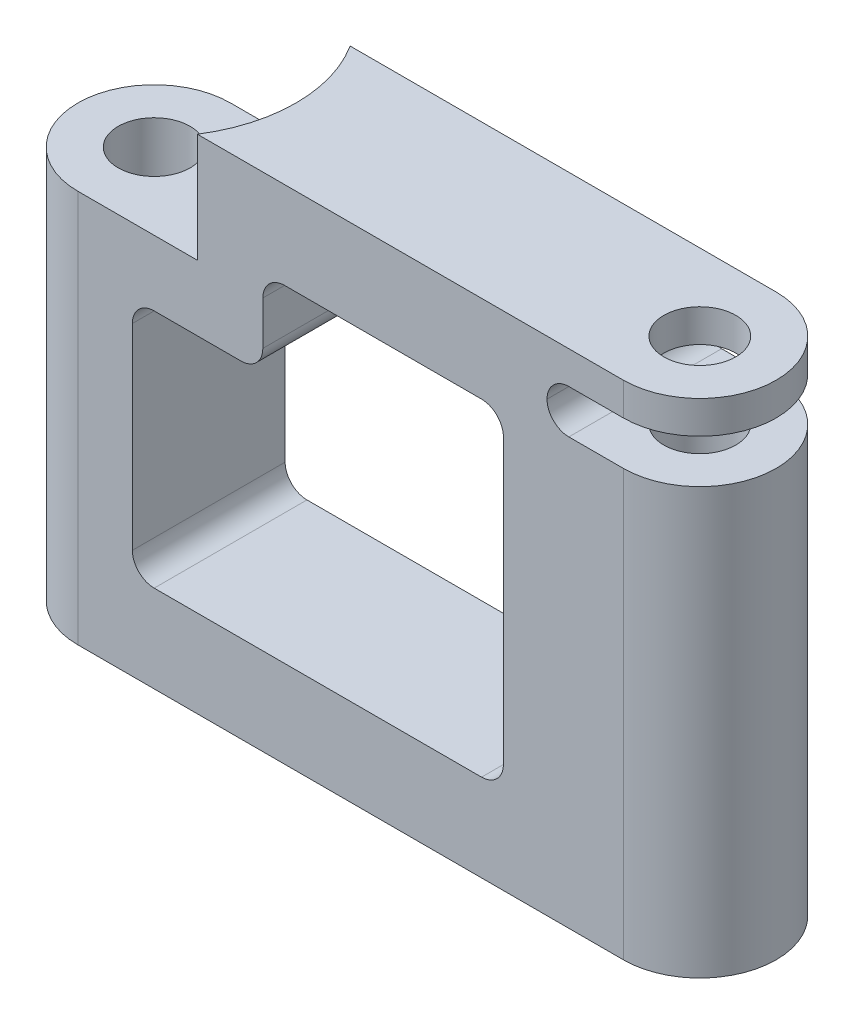
from build123d import *

# Parameters (mm, degrees)
EXTRUDE_1_DEPTH     = 11.5
SKETCH_2_R          = 1.65
CUT_EXTRUDE_1_DEPTH = 46.5
SKETCH_4_R          = 6.5
CUT_EXTRUDE_2_DEPTH = 5
SKETCH_5_W          = 7
SKETCH_5_H          = 2
CUT_EXTRUDE_3_DEPTH = 10
FILLET_1_R          = 1
CUT_EXTRUDE_4_DEPTH = 25
FILLET_2_R          = 1


with BuildPart() as part:
    # 草图1 → 凸台-拉伸1 (new, symmetric)
    with BuildSketch(Plane(origin=(0, 0, 0), x_dir=(1, 0, 0), z_dir=(0, 1, 0))):
        with BuildLine():
            Line((-12.5, 3.5), (12.5, 3.5))
            ThreePointArc((12.5, 3.5), (16, 0), (12.5, -3.5))
            Line((12.5, -3.5), (-12.5, -3.5))
            ThreePointArc((-12.5, -3.5), (-16, 0), (-12.5, 3.5))
        make_face()
    extrude(amount=EXTRUDE_1_DEPTH, both=True)

    # 草图2 → 切除-拉伸1 (cut, symmetric)
    with BuildSketch(Plane(origin=(0, 11.5, 0), x_dir=(1, 0, 0), z_dir=(0, 1, 0))):
        with Locations(Location((12.5, 0, 0), (0, 0, 270))):
            Circle(SKETCH_2_R)
        with Locations(Location((-12.5, 0, 0), (0, 0, 270))):
            Circle(SKETCH_2_R)
    extrude(amount=CUT_EXTRUDE_1_DEPTH, both=True, mode=Mode.SUBTRACT)

    # 草图4 → 切除-拉伸2 (cut, symmetric)
    with BuildSketch(Plane(origin=(0, 11.5, 0), x_dir=(1, 0, 0), z_dir=(0, 1, 0))):
        with Locations((-12.5, 0)):
            Circle(SKETCH_4_R)
    extrude(amount=CUT_EXTRUDE_2_DEPTH, both=True, mode=Mode.SUBTRACT)

    # 草图5 → 切除-拉伸3 (cut, symmetric)
    with BuildSketch(Plane.XY.offset(3.5)):
        with Locations((12.5, 9)):
            Rectangle(SKETCH_5_W, SKETCH_5_H)
    extrude(amount=CUT_EXTRUDE_3_DEPTH, both=True, mode=Mode.SUBTRACT)

    # 圆角1
    fillet_1_edges = [part.edges().sort_by_distance(p)[0] for p in [
        (9, 8, 0),
        (9, 10, 0),
    ]]
    fillet(fillet_1_edges, radius=FILLET_1_R - 0.0001)  # a hair under: the kernel refuses the full size

    # 草图6 → 切除-拉伸4 (cut, symmetric)
    with BuildSketch(Plane.XY.offset(3.5)):
        Polygon((-10, 3.5), (-10, -7.5), (7, -7.5), (7, 7.5), (-4.022774425, 7.5), (-4.022774425, 3.5), align=None)
    extrude(amount=CUT_EXTRUDE_4_DEPTH, both=True, mode=Mode.SUBTRACT)

    # 圆角2
    fillet_2_edges = [part.edges().sort_by_distance(p)[0] for p in [
        (-10, 3.5, 0),
        (-4.022774425, 3.5, 0),
        (-4.022774425, 7.5, 0),
        (7, 7.5, 0),
        (7, -7.5, 0),
        (-10, -7.5, 0),
    ]]
    fillet(fillet_2_edges, radius=FILLET_2_R)


solid = part.part
